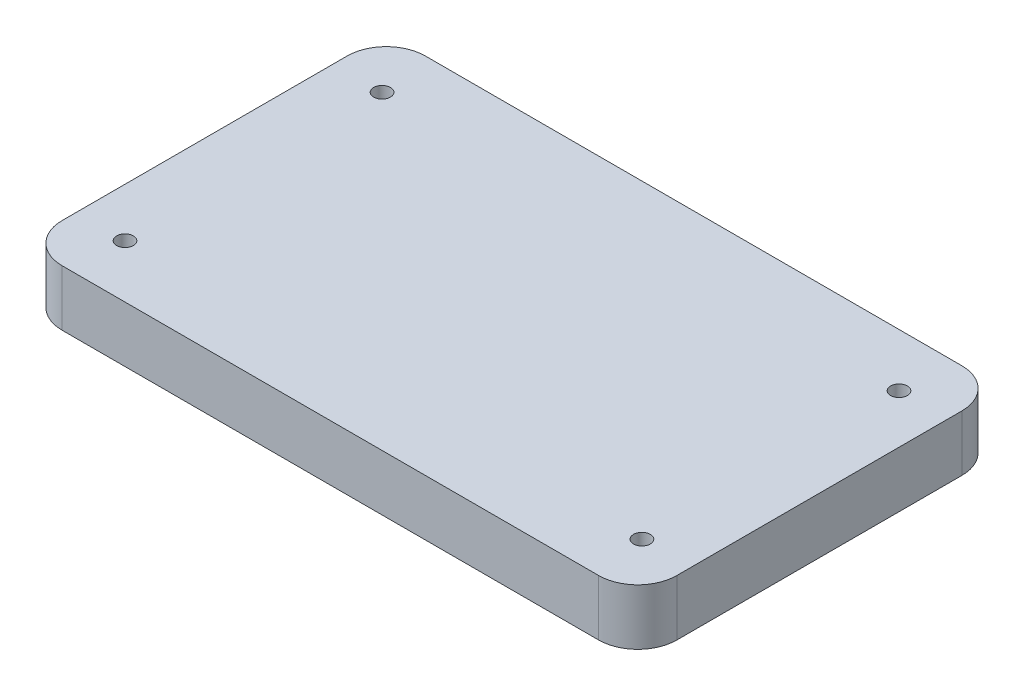
from build123d import *

# Parameters (mm, degrees)
SKETCH1_R           = 1.5
BOSS_EXTRUDE1_DEPTH = 5


with BuildPart() as part:
    # Sketch1 → Boss-Extrude1 (new, symmetric)
    with BuildSketch(Plane(origin=(0, 0, 0), x_dir=(1, 0, 0), z_dir=(0, 1, 0))):
        with BuildLine():
            Line((48, -32.5), (-48, -32.5))
            ThreePointArc((-48, -32.5), (-52.949747468, -30.449747468), (-55, -25.5))
            Line((-55, -25.5), (-55, 25.5))
            ThreePointArc((-55, 25.5), (-52.949747468, 30.449747468), (-48, 32.5))
            Line((-48, 32.5), (48, 32.5))
            ThreePointArc((48, 32.5), (52.949747468, 30.449747468), (55, 25.5))
            Line((55, 25.5), (55, -25.5))
            ThreePointArc((55, -25.5), (52.949747468, -30.449747468), (48, -32.5))
        make_face()
        with Locations((-46.25, 23)):
            Circle(SKETCH1_R, mode=Mode.SUBTRACT)
        with Locations((-46.25, -23)):
            Circle(SKETCH1_R, mode=Mode.SUBTRACT)
        with Locations((46.25, -23)):
            Circle(SKETCH1_R, mode=Mode.SUBTRACT)
        with Locations((46.25, 23)):
            Circle(SKETCH1_R, mode=Mode.SUBTRACT)
    extrude(amount=BOSS_EXTRUDE1_DEPTH, both=True)


solid = part.part
